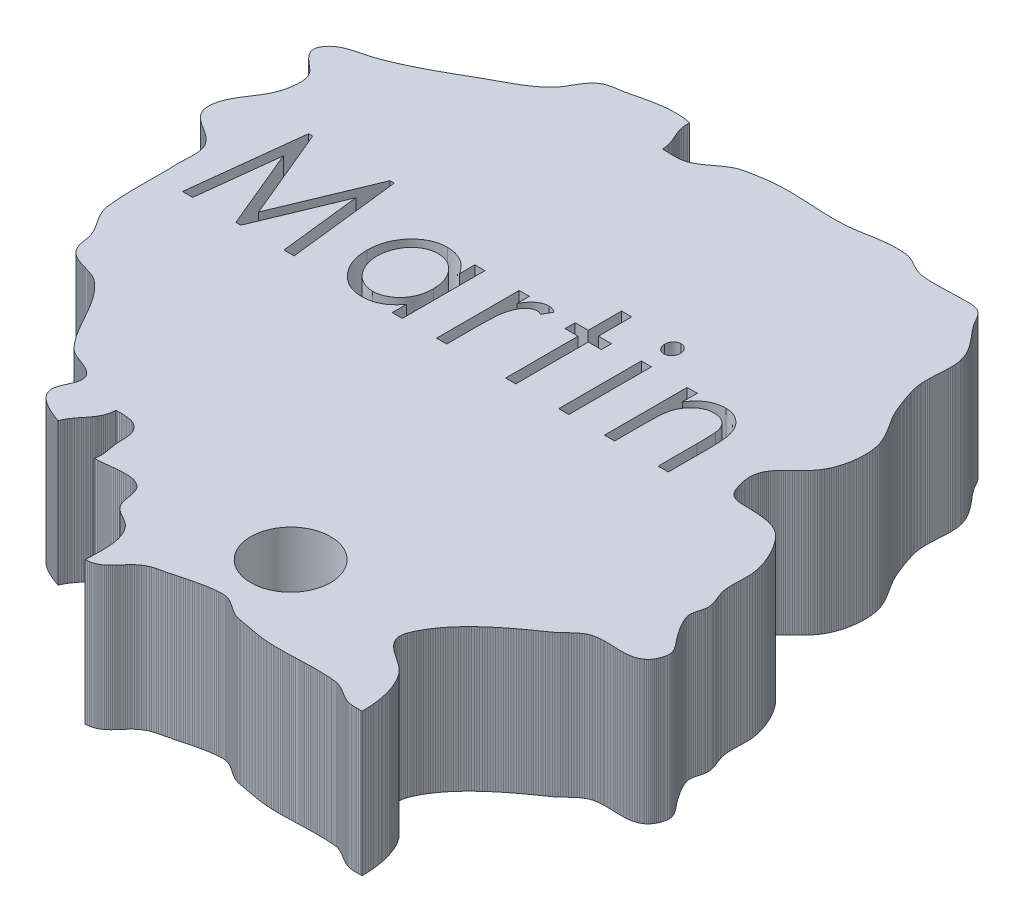
from build123d import *

# Parameters (mm, degrees)
BOSS_EXTRUDE1_DEPTH   = 2
SKETCH1_W             = 0.142467949
SKETCH1_H             = 1.160096154
BOSS_EXTRUDE1_2_DEPTH = 2
SKETCH2_R             = 0.560427
CUT_EXTRUDE1_DEPTH    = 4


with BuildPart() as part:
    # Sketch1 → Boss-Extrude1 (new body)
    with BuildSketch(Plane(origin=(0, 0, 0), x_dir=(1, 0, 0), z_dir=(0, 1, 0))):
        with BuildLine():
            add(Edge.make_bspline(
                [(5.178357098, 6.195814519), (5.160701843, 6.195074753), (5.125776035, 6.193611339), (5.074488584, 6.182057957), (5.025406252, 6.163029209), (4.978734159, 6.136923399), (4.935281677, 6.104176898), (4.89669302, 6.064622526), (4.862599823, 6.019194201), (4.833878764, 5.96841443), (4.810323139, 5.913978043), (4.793420868, 5.857205665), (4.783299996, 5.798770344), (4.781879498, 5.759333526), (4.78116409, 5.739471871)],
                knots=[0, 0, 0, 0, 0.94589833, 1.871185778, 2.803151577, 3.759796684, 4.729387238, 5.709991986, 6.712535966, 7.766410933, 8.830579752, 9.886108481, 10.935375986, 12, 12, 12, 12], degree=3))
            add(Edge.make_bspline(
                [(4.78116409, 5.739471871), (4.781851797, 5.719711547), (4.783221552, 5.6803535), (4.793818467, 5.622080741), (4.810768654, 5.56513725), (4.834040833, 5.510186586), (4.863372336, 5.459095653), (4.897520441, 5.413056849), (4.9366487, 5.373177758), (4.980257461, 5.339936692), (5.026740356, 5.312989873), (5.07572273, 5.294211419), (5.126144692, 5.282084853), (5.160480508, 5.280663047), (5.177721081, 5.279949135)],
                knots=[0, 0, 0, 0, 1.057784853, 2.106865525, 3.161232352, 4.234669004, 5.295131721, 6.309061728, 7.296615406, 8.276535484, 9.237709944, 10.163355204, 11.077790723, 12, 12, 12, 12], degree=3))
            add(Edge.make_bspline(
                [(5.177721081, 5.279949135), (5.195162835, 5.280706342), (5.229976864, 5.282217739), (5.281351871, 5.293755463), (5.33119447, 5.312806554), (5.378848682, 5.339140475), (5.423242562, 5.371802168), (5.463129899, 5.409997742), (5.496574641, 5.454329381), (5.525076638, 5.502993642), (5.547155213, 5.5563562), (5.563444776, 5.61306958), (5.573185059, 5.673203342), (5.574329029, 5.71431304), (5.57491409, 5.735337756)],
                knots=[0, 0, 0, 0, 0.932437919, 1.861161448, 2.801599735, 3.778660743, 4.764224575, 5.742699635, 6.721470402, 7.725153891, 8.751941618, 9.801891719, 10.87582232, 12, 12, 12, 12], degree=3))
            add(Edge.make_bspline(
                [(5.57491409, 5.735337756), (5.57449034, 5.751353436), (5.573657531, 5.782829556), (5.568790941, 5.829195967), (5.559296538, 5.87334354), (5.547120504, 5.915747064), (5.530580297, 5.955789309), (5.511458832, 5.994388786), (5.487476602, 6.030183596), (5.461160581, 6.064240143), (5.431608158, 6.09464368), (5.400870853, 6.122132494), (5.367795344, 6.144881262), (5.332986179, 6.163193933), (5.296826848, 6.178298401), (5.258683954, 6.188124353), (5.219095347, 6.194948851), (5.192061629, 6.195523305), (5.178357098, 6.195814519)],
                knots=[0, 0, 0, 0, 1.135070593, 2.23079002, 3.297312838, 4.331146457, 5.352130785, 6.36323152, 7.377785783, 8.399543416, 9.408885011, 10.377612658, 11.31725054, 12.244650473, 13.161035038, 14.086608181, 15.030021048, 16, 16, 16, 16], degree=3))
        make_face()
    extrude(amount=BOSS_EXTRUDE1_DEPTH)


with BuildPart() as body_2:
    # Sketch1 → Boss-Extrude1 2 (new body)
    with BuildSketch(Plane(origin=(0, 0, 0), x_dir=(1, 0, 0), z_dir=(0, 1, 0))):
        Polygon((11.372342435, 3.810000062), (11.368885496, 3.83661412), (11.363457516, 3.86264404), (11.356419176, 3.8881939), (11.348138776, 3.91337546), (11.338987156, 3.93829794), (11.329327536, 3.9630731), (11.319530756, 3.9878127), (11.309962576, 4.01262342), (11.300988756, 4.03761702), (11.292980136, 4.06290526), (11.286302476, 4.08859482), (11.281324076, 4.1148), (11.278039856, 4.1399333), (11.275690356, 4.16516058), (11.274156196, 4.19046406), (11.273307836, 4.21583358), (11.273025896, 4.24125898), (11.273180836, 4.26672502), (11.273648196, 4.29222408), (11.274308596, 4.31774346), (11.275035036, 4.34327046), (11.275700516, 4.36879238), (11.276185656, 4.3943016), (11.276363456, 4.41978034), (11.276106916, 4.44522352), (11.275294116, 4.47061336), (11.273803136, 4.49594224), (11.271504436, 4.5212), (11.268649476, 4.54394316), (11.265002036, 4.5670978), (11.260579896, 4.59061058), (11.255410996, 4.61443324), (11.249513116, 4.63851498), (11.242914196, 4.662805), (11.235632016, 4.6872525), (11.227694516, 4.71180922), (11.219119476, 4.73642182), (11.209932296, 4.76104204), (11.200155836, 4.78561654), (11.189812956, 4.8100996), (11.178923976, 4.83443534), (11.167514296, 4.85857804), (11.155606776, 4.88247436), (11.143224276, 4.9060735), (11.130387116, 4.9293272), (11.117120696, 4.95218466), (11.103445336, 4.97459254), (11.089386436, 4.99650512), (11.074966856, 5.01786906), (11.060206916, 5.03863356), (11.045129476, 5.05875036), (11.029759936, 5.07816612), (11.014121156, 5.09683258), (10.998233456, 5.11469894), (10.982119696, 5.1317144), (10.965802736, 5.1478307), (10.946808616, 5.1646709), (10.926884856, 5.17995916), (10.906097496, 5.19377168), (10.884520196, 5.20618974), (10.862218996, 5.21729716), (10.839262476, 5.22717014), (10.815719216, 5.2358925), (10.791657796, 5.24354552), (10.767149336, 5.2502054), (10.742259876, 5.25595596), (10.717060536, 5.26087848), (10.691619896, 5.26504916), (10.666003996, 5.26855436), (10.640283956, 5.27147028), (10.614530896, 5.27388074), (10.588810856, 5.27586194), (10.563189876, 5.27750024), (10.537744156, 5.2788693), (10.512534656, 5.28005802), (10.487637576, 5.28114006), (10.463116416, 5.28219924), (10.438521596, 5.2830222), (10.414018216, 5.28351242), (10.389707876, 5.28394168), (10.365702336, 5.28459446), (10.342108276, 5.28574762), (10.319034916, 5.28768056), (10.296588936, 5.29067268), (10.274877016, 5.29500084), (10.254010916, 5.30094952), (10.234097316, 5.30879304), (10.215242896, 5.3188108), (10.197556876, 5.33128474), (10.181145936, 5.34649426), (10.166121836, 5.36471622), (10.152588716, 5.38622748), (10.140655796, 5.41131506), (10.131153656, 5.43534854), (10.122144276, 5.4601364), (10.113744496, 5.48547036), (10.106081316, 5.51113452), (10.099271576, 5.53691806), (10.093437196, 5.56261016), (10.088700096, 5.588), (10.084968836, 5.61495702), (10.082802216, 5.6408955), (10.082131656, 5.66586116), (10.082898736, 5.68990226), (10.085034876, 5.71306198), (10.088479116, 5.73538858), (10.093167956, 5.75693032), (10.099040436, 5.77773038), (10.106027976, 5.79783702), (10.114072156, 5.8172985), (10.123106936, 5.836158), (10.133068816, 5.85446632), (10.143894296, 5.8722641), (10.155522416, 5.88960468), (10.167889676, 5.9065287), (10.180927496, 5.92308442), (10.194579996, 5.93932264), (10.208778596, 5.955284), (10.223462336, 5.9710193), (10.238565176, 5.98657172), (10.254026156, 6.00198952), (10.269781776, 6.01732096), (10.285768536, 6.03260922), (10.301920396, 6.04790256), (10.318178936, 6.06324924), (10.334475576, 6.07869244), (10.350751896, 6.09428042), (10.366941856, 6.1100589), (10.382981956, 6.12607614), (10.398808696, 6.14237786), (10.414358576, 6.15901232), (10.429570636, 6.1760227), (10.444378836, 6.19345726), (10.458719676, 6.21136172), (10.472532196, 6.22978434), (10.485752896, 6.24877084), (10.498788176, 6.26911624), (10.511155436, 6.29014998), (10.522852136, 6.31182634), (10.533883356, 6.33410214), (10.544251636, 6.35693166), (10.553951896, 6.38027172), (10.562994296, 6.4040766), (10.571373756, 6.42829804), (10.579092816, 6.45289794), (10.586156556, 6.4778255), (10.592564976, 6.50304008), (10.598318076, 6.52849596), (10.603415856, 6.55414742), (10.607865936, 6.57994874), (10.611665776, 6.60585928), (10.614815376, 6.63183078), (10.617319816, 6.65781752), (10.619179096, 6.68377886), (10.620395756, 6.70966654), (10.620969796, 6.73543738), (10.620903756, 6.7610482), (10.620197636, 6.78645074), (10.618856516, 6.81160182), (10.616877856, 6.83645572), (10.614266736, 6.8609718), (10.611020616, 6.88509926), (10.607147116, 6.9088), (10.602145856, 6.93345832), (10.596062556, 6.9577712), (10.588968336, 6.98175642), (10.580936856, 7.00542668), (10.572041776, 7.02880484), (10.562354216, 7.05190868), (10.551947836, 7.07475344), (10.540893756, 7.0973569), (10.529263096, 7.11973938), (10.517132056, 7.14191866), (10.504571756, 7.16391252), (10.491653316, 7.1857362), (10.478452936, 7.20741002), (10.465039196, 7.22894922), (10.451485756, 7.25037666), (10.437866276, 7.27170504), (10.424251876, 7.29295468), (10.410716216, 7.3141459), (10.397332956, 7.3352914), (10.384170676, 7.3564115), (10.371305576, 7.37752652), (10.358811316, 7.39864916), (10.347729296, 7.41832908), (10.336718396, 7.43908342), (10.325798936, 7.4608055), (10.314986156, 7.4833861), (10.304300376, 7.50671854), (10.293761916, 7.53069868), (10.283388556, 7.55521476), (10.273200616, 7.5801601), (10.263213336, 7.60543056), (10.253452116, 7.63091438), (10.243929656, 7.65650742), (10.234668816, 7.68210046), (10.225687376, 7.70758682), (10.217005656, 7.73285982), (10.208641436, 7.75781278), (10.200612496, 7.78233648), (10.192941696, 7.80632424), (10.185644276, 7.82966938), (10.178740556, 7.85226268), (10.172250856, 7.874), (10.165829736, 7.8978379), (10.160483036, 7.922006), (10.156137096, 7.9464789), (10.152708096, 7.97122866), (10.150122376, 7.99622988), (10.148296116, 8.02145462), (10.147153116, 8.04688002), (10.146617176, 8.07247814), (10.146604476, 8.09822612), (10.147041356, 8.12409348), (10.147849076, 8.15005482), (10.148943816, 8.17608728), (10.150254456, 8.20216292), (10.151694636, 8.22825634), (10.153193236, 8.2543396), (10.154666436, 8.28038984), (10.156038036, 8.30637912), (10.157226756, 8.33228204), (10.158158936, 8.3580732), (10.158753296, 8.38372466), (10.158928556, 8.40921356), (10.158611056, 8.43450942), (10.157719516, 8.45958938), (10.156177736, 8.48442804), (10.153904436, 8.509), (10.150457656, 8.53457018), (10.145811996, 8.55951044), (10.140028416, 8.58385126), (10.133165336, 8.60762566), (10.125286256, 8.63086412), (10.116452136, 8.6536022), (10.106721396, 8.67586784), (10.096157536, 8.6976966), (10.084818976, 8.71911896), (10.072769216, 8.74017048), (10.060066676, 8.76087656), (10.046772316, 8.78127784), (10.032952176, 8.80139972), (10.018659596, 8.82127776), (10.003960616, 8.84094244), (9.988913656, 8.86042932), (9.973579676, 8.87976634), (9.958022176, 8.89898906), (9.942299576, 8.91812796), (9.926472836, 8.93721606), (9.910605456, 8.95628638), (9.894753316, 8.97536686), (9.878982456, 8.9944956), (9.863351296, 9.01370054), (9.847920796, 9.03301724), (9.832751916, 9.05247618), (9.817905616, 9.07211038), (9.803450476, 9.09296886), (9.789942756, 9.11480524), (9.777003996, 9.13725122), (9.764248116, 9.15994866), (9.751296656, 9.18253434), (9.737771156, 9.2046425), (9.723288076, 9.22591246), (9.707471496, 9.24598354), (9.689935336, 9.26448998), (9.670306216, 9.28107364), (9.648845756, 9.29474138), (9.625965436, 9.30522904), (9.601904016, 9.31293032), (9.576910416, 9.318244), (9.551225936, 9.32156124), (9.525094416, 9.32328336), (9.498762236, 9.32380406), (9.472475776, 9.32351958), (9.446473796, 9.32282616), (9.421005216, 9.32212004), (9.396316416, 9.3218), (9.371411716, 9.32167554), (9.346344456, 9.32133264), (9.321132416, 9.32080686), (9.295790836, 9.32013376), (9.270337496, 9.31935652), (9.244792716, 9.3185107), (9.219169196, 9.3176344), (9.193487256, 9.3167708), (9.167762136, 9.31595038), (9.142016696, 9.31521886), (9.116261096, 9.3146118), (9.090518196, 9.31416476), (9.064803236, 9.31392092), (9.039133996, 9.31391838), (9.013528256, 9.31419016), (8.988001256, 9.31478198), (8.962573316, 9.31572686), (8.937262216, 9.31706798), (8.912083196, 9.31883836), (8.887054036, 9.32107864), (8.862192516, 9.32382946), (8.837516416, 9.32712892), (8.811598256, 9.33206668), (8.786551316, 9.33898564), (8.762243516, 9.34757846), (8.738550396, 9.35754034), (8.715344956, 9.36856648), (8.692495116, 9.38035462), (8.669876416, 9.39259742), (8.647361856, 9.40499516), (8.624821896, 9.41723796), (8.602129536, 9.42902356), (8.579155236, 9.4400497), (8.555777076, 9.45001158), (8.531860436, 9.45860186), (8.507283396, 9.46551828), (8.481916416, 9.47045604), (8.455472476, 9.47400188), (8.429183476, 9.47676794), (8.403034176, 9.47879486), (8.377022036, 9.48012074), (8.351134356, 9.48078622), (8.325363516, 9.48083448), (8.299701896, 9.48030616), (8.274141876, 9.47923936), (8.248673296, 9.4776798), (8.223291076, 9.47566304), (8.197982516, 9.4732348), (8.172739996, 9.47043064), (8.147558436, 9.46729628), (8.122427676, 9.46387236), (8.097337556, 9.46019698), (8.072280456, 9.45631332), (8.047251296, 9.45226202), (8.022237376, 9.44808118), (7.997231076, 9.44381398), (7.972224776, 9.4395036), (7.947213396, 9.4351856), (7.922181696, 9.4309057), (7.897127136, 9.426702), (7.872037016, 9.42261768), (7.846906256, 9.41869084), (7.821727236, 9.41496466), (7.796487256, 9.41147978), (7.771178696, 9.40827684), (7.745799016, 9.40539648), (7.720332976, 9.4028768), (7.694772956, 9.40076352), (7.669116416, 9.39909728), (7.644275216, 9.3978603), (7.619342576, 9.39690018), (7.594321036, 9.39620168), (7.569218216, 9.39574956), (7.544036656, 9.39552604), (7.518778896, 9.39551588), (7.493452556, 9.3957013), (7.468062716, 9.39606706), (7.442611916, 9.39659792), (7.417107776, 9.3972761), (7.391550296, 9.39808636), (7.365949636, 9.39901092), (7.340305796, 9.40003708), (7.314626396, 9.40114452), (7.288916516, 9.40232054), (7.263178696, 9.40354482), (7.237418016, 9.4048072), (7.211639556, 9.40608482), (7.185848396, 9.40736752), (7.160049616, 9.40863498), (7.134248296, 9.40987196), (7.108446976, 9.41106322), (7.082650736, 9.41219352), (7.056864656, 9.41324254), (7.031096356, 9.41420012), (7.005345836, 9.4150434), (6.979620716, 9.41576222), (6.953923536, 9.41633626), (6.928261916, 9.41675028), (6.902638396, 9.41698904), (6.877058056, 9.41703476), (6.851525976, 9.41687474), (6.826044696, 9.41648866), (6.800624376, 9.41586128), (6.775265016, 9.4149799), (6.749971696, 9.4138242), (6.724749496, 9.41237894), (6.699603496, 9.41062888), (6.674538776, 9.40855878), (6.649560416, 9.40614832), (6.624673496, 9.40338734), (6.599878016, 9.40025298), (6.575184136, 9.39673508), (6.550594396, 9.39281332), (6.526116416, 9.388475), (6.501981336, 9.3841824), (6.476809936, 9.37999902), (6.450843516, 9.37580548), (6.424323376, 9.37147732), (6.397490816, 9.36689262), (6.370592216, 9.361932), (6.343863796, 9.35646846), (6.317554476, 9.35038262), (6.291900476, 9.34355256), (6.267150716, 9.33585382), (6.243538876, 9.32716702), (6.221316416, 9.31737024), (6.199124436, 9.30600374), (6.177323616, 9.29370252), (6.155860616, 9.2805885), (6.134682096, 9.26678614), (6.113734716, 9.2524199), (6.092965136, 9.2376117), (6.072322556, 9.222486), (6.051748556, 9.20716726), (6.031194876, 9.19177486), (6.010603096, 9.17643834), (5.989924956, 9.16127708), (5.969104576, 9.146413), (5.948091156, 9.13197564), (5.926826276, 9.11808438), (5.905261676, 9.10486368), (5.883338936, 9.09243546), (5.861012336, 9.08092672), (5.838220916, 9.07045684), (5.814916416, 9.06115536), (5.791421416, 9.05360394), (5.767151716, 9.04780258), (5.742226696, 9.04354808), (5.716773356, 9.04064486), (5.690918696, 9.03888972), (5.664789716, 9.03808708), (5.638510876, 9.03803882), (5.612206636, 9.03854174), (5.586001456, 9.03940026), (5.560024876, 9.04041372), (5.534401356, 9.041384), (5.509257896, 9.04211298), (5.484716416, 9.0424), (5.483248296, 9.06841214), (5.480246016, 9.0935556), (5.475869596, 9.11791166), (5.470296836, 9.1415743), (5.463692836, 9.16462988), (5.456225236, 9.18716984), (5.448066756, 9.20928308), (5.439385036, 9.2310585), (5.430350256, 9.252585), (5.421130056, 9.27395402), (5.411894616, 9.29524938), (5.402811576, 9.31656506), (5.394056196, 9.33798996), (5.385788496, 9.35961044), (5.378186276, 9.38152048), (5.371414636, 9.4038039), (5.365643756, 9.42655214), (5.361041276, 9.44985664), (5.357777376, 9.47380376), (5.356022236, 9.4984824), (5.355946036, 9.52398654), (5.357716416, 9.5504), (5.332354516, 9.55601848), (5.306944356, 9.56083432), (5.281491016, 9.56487546), (5.255994496, 9.56817238), (5.230462416, 9.57075048), (5.204899856, 9.57264278), (5.179309356, 9.57387468), (5.153701076, 9.57447666), (5.128072476, 9.57447666), (5.102433716, 9.5739077), (5.076784796, 9.57279264), (5.051135876, 9.5711645), (5.025489496, 9.56905122), (4.999848196, 9.56648074), (4.974219596, 9.56348608), (4.948608776, 9.5600901), (4.923018276, 9.55632582), (4.897450636, 9.55221864), (4.871916016, 9.54780158), (4.846416956, 9.54310258), (4.820958536, 9.53814958), (4.795545836, 9.53297052), (4.770181396, 9.52759842), (4.744870296, 9.52205614), (4.719620156, 9.5163767), (4.694430976, 9.51059058), (4.669312916, 9.50472318), (4.644268516, 9.49880498), (4.619300316, 9.49286392), (4.594415936, 9.48692794), (4.569620456, 9.48103006), (4.544916416, 9.47519822), (4.519224316, 9.46970166), (4.493265516, 9.46500012), (4.467141616, 9.4607888), (4.440954216, 9.45675782), (4.414804916, 9.45259984), (4.388797856, 9.44801006), (4.363037176, 9.44268368), (4.337621936, 9.43631082), (4.312661356, 9.42858668), (4.288251956, 9.41920138), (4.264497876, 9.4078552), (4.241505796, 9.39423572), (4.221762376, 9.38002442), (4.203309276, 9.36437802), (4.186009336, 9.3474413), (4.169733016, 9.32935396), (4.154348236, 9.31026332), (4.139720376, 9.29031416), (4.125719896, 9.26964872), (4.112214716, 9.24841432), (4.099070216, 9.22675066), (4.086154316, 9.20480506), (4.073337476, 9.1827223), (4.060482536, 9.16064208), (4.047462496, 9.13871426), (4.034142736, 9.11708108), (4.020391176, 9.09588478), (4.006075736, 9.07527268), (3.991064336, 9.05538448), (3.975222356, 9.03637004), (3.958422796, 9.0183716), (3.940464996, 9.00080242), (3.921933156, 8.9836498), (3.902862836, 8.96689342), (3.883281976, 8.95051804), (3.863226136, 8.93450588), (3.842728336, 8.91883916), (3.821819056, 8.90350264), (3.800531316, 8.88847854), (3.778895596, 8.87375162), (3.756947456, 8.85930156), (3.734717376, 8.84511566), (3.712238376, 8.83117106), (3.689543476, 8.8174576), (3.666665696, 8.80395242), (3.643635516, 8.79064282), (3.620485956, 8.77751102), (3.597250036, 8.76453924), (3.573958236, 8.7517097), (3.550646116, 8.73900462), (3.527341616, 8.7264113), (3.504082836, 8.71390942), (3.480897716, 8.70148374), (3.457821816, 8.68911394), (3.434885616, 8.67678732), (3.412122136, 8.6644861), (3.389561856, 8.6521925), (3.367240336, 8.6398862), (3.345188056, 8.62755704), (3.323440576, 8.6151847), (3.301449256, 8.60255074), (3.279412216, 8.58989646), (3.257326916, 8.5772244), (3.235190816, 8.56453964), (3.213008996, 8.5518498), (3.190776376, 8.53915996), (3.168495496, 8.52648028), (3.146166356, 8.51381076), (3.123791496, 8.50116156), (3.101365836, 8.48853776), (3.078894456, 8.47594698), (3.056372276, 8.46339176), (3.033804376, 8.45088226), (3.011190756, 8.43842356), (2.988526336, 8.42602074), (2.965816196, 8.41368142), (2.943060336, 8.40140814), (2.920253676, 8.38921106), (2.897403836, 8.3770978), (2.874503196, 8.36506836), (2.851559376, 8.35313544), (2.828567296, 8.34129904), (2.805526956, 8.32957186), (2.782440896, 8.3179539), (2.759309116, 8.30645532), (2.736131616, 8.2950812), (2.712905856, 8.28383916), (2.689636916, 8.27273174), (2.666319716, 8.2617691), (2.642956796, 8.25095378), (2.619548156, 8.2402934), (2.596096336, 8.22979558), (2.572596256, 8.2194654), (2.549050456, 8.20931048), (2.525458936, 8.19933336), (2.501824236, 8.1895442), (2.478143816, 8.17994554), (2.454417676, 8.170545), (2.430645816, 8.16135274), (2.406830776, 8.15236876), (2.382970016, 8.14360068), (2.359066076, 8.13505866), (2.335116416, 8.12674524), (2.313490856, 8.11969928), (2.291263316, 8.11306734), (2.268527776, 8.10674274), (2.245373136, 8.10062896), (2.221898456, 8.0946244), (2.198190096, 8.08863508), (2.174344576, 8.08255686), (2.150453336, 8.07629322), (2.126607816, 8.0697451), (2.102904536, 8.06280836), (2.079429856, 8.05538902), (2.056282836, 8.04738802), (2.033552376, 8.03870122), (2.011332456, 8.0292321), (1.989714516, 8.01888414), (1.968792536, 8.0075532), (1.948660496, 7.99514276), (1.929407296, 7.98155122), (1.911129456, 7.9666846), (1.893915876, 7.95043622), (1.877860536, 7.93271464), (1.863059956, 7.91341318), (1.849600496, 7.89243786), (1.837581216, 7.86968708), (1.829001096, 7.84783546), (1.824175096, 7.82658074), (1.822826356, 7.80589752), (1.824672936, 7.78575786), (1.829430356, 7.76614144), (1.836821756, 7.74702032), (1.846565196, 7.7283691), (1.858378736, 7.71015984), (1.871980436, 7.69237222), (1.887093436, 7.67497576), (1.903435796, 7.65795014), (1.920723036, 7.64126488), (1.938675756, 7.62489966), (1.957017096, 7.608824), (1.975462576, 7.59301504), (1.993730256, 7.57744738), (2.011540736, 7.56209816), (2.028614616, 7.5469369), (2.044669956, 7.53194074), (2.059427356, 7.51708428), (2.072602336, 7.50234212), (2.083918036, 7.48768632), (2.097603556, 7.46576358), (2.108718596, 7.44281468), (2.117456196, 7.41897678), (2.124009396, 7.39438958), (2.128576316, 7.36919024), (2.131349996, 7.34351846), (2.132526016, 7.31751394), (2.132299956, 7.2913113), (2.130864856, 7.26505532), (2.128416296, 7.23887808), (2.125152396, 7.21292436), (2.121261116, 7.18732878), (2.116943116, 7.16223104), (2.112393976, 7.13777084), (2.107385096, 7.11447396), (2.101385616, 7.09155554), (2.094456496, 7.06899018), (2.086666316, 7.04675756), (2.078078576, 7.02483228), (2.068761856, 7.00319402), (2.058779656, 6.98181992), (2.048200556, 6.96068458), (2.037088056, 6.93977022), (2.025510736, 6.91905144), (2.013534636, 6.89850792), (2.001220716, 6.87811172), (1.988640096, 6.8578476), (1.975858816, 6.83768762), (1.962940376, 6.81761146), (1.949950816, 6.79759626), (1.936958716, 6.77761916), (1.924027576, 6.75765984), (1.911223436, 6.73769036), (1.898614876, 6.71769548), (1.886262856, 6.69764726), (1.874241036, 6.67752284), (1.862607836, 6.65730444), (1.851434376, 6.63696666), (1.840784156, 6.61648664), (1.830723216, 6.59584152), (1.821317596, 6.57500844), (1.812635876, 6.55396708), (1.804739016, 6.53269458), (1.797698136, 6.51116808), (1.791576736, 6.48936472), (1.786440856, 6.4672591), (1.782356536, 6.44483344), (1.779392356, 6.42206234), (1.777609276, 6.39892548), (1.777078416, 6.3754), (1.778008056, 6.35283718), (1.780522656, 6.33142752), (1.784543476, 6.31111006), (1.789986696, 6.2918213), (1.796773576, 6.27350536), (1.804825376, 6.2560962), (1.814063356, 6.2395354), (1.824403696, 6.22376454), (1.835767656, 6.20871504), (1.848076496, 6.19433356), (1.861246396, 6.1805566), (1.875203696, 6.1673232), (1.889862036, 6.15456986), (1.905145216, 6.1422407), (1.920971956, 6.13026968), (1.937260976, 6.11860092), (1.953936076, 6.10716838), (1.970910896, 6.09591364), (1.988111776, 6.08477828), (2.005454896, 6.07369626), (2.022861516, 6.06260916), (2.040252896, 6.05145602), (2.057545216, 6.04017842), (2.074659736, 6.02871032), (2.091517716, 6.01699584), (2.108040416, 6.00496894), (2.124144016, 5.99257374), (2.139752316, 5.9797442), (2.154781496, 5.96642444), (2.169152816, 5.95255096), (2.182787536, 5.9380628), (2.195606916, 5.922899), (2.207524596, 5.90700114), (2.218466916, 5.89030318), (2.228352596, 5.87274924), (2.237097816, 5.85427328), (2.244626376, 5.83481942), (2.250859536, 5.81432416), (2.256310376, 5.79054468), (2.260369296, 5.76622164), (2.263198856, 5.74143632), (2.264961616, 5.7162573), (2.265812516, 5.6907684), (2.265919196, 5.66504582), (2.265441676, 5.63916068), (2.264537436, 5.6131968), (2.263374116, 5.5872253), (2.262109196, 5.56132746), (2.260902696, 5.53557694), (2.259919716, 5.51005248), (2.259320276, 5.48483028), (2.259264396, 5.45998654), (2.259914636, 5.4356), (2.260915396, 5.41080706), (2.261758676, 5.3859049), (2.262459716, 5.36090114), (2.263028676, 5.33579832), (2.263475716, 5.3106066), (2.263813536, 5.28533106), (2.264052296, 5.25997678), (2.264204696, 5.23454884), (2.264280896, 5.2090574), (2.264296136, 5.18350754), (2.264258036, 5.15790434), (2.264179296, 5.13225288), (2.264072616, 5.10656332), (2.263948156, 5.0808382), (2.263818616, 5.05508514), (2.263694156, 5.02930922), (2.263590016, 5.0035206), (2.263511276, 4.97772182), (2.263475716, 4.9519205), (2.263493496, 4.92612426), (2.263572236, 4.90033564), (2.263727176, 4.8745648), (2.263971016, 4.84881428), (2.264311376, 4.82309424), (2.264760956, 4.79740976), (2.265334996, 4.77176592), (2.266041116, 4.7461678), (2.266892016, 4.72062556), (2.267897856, 4.69514174), (2.269073876, 4.6697265), (2.270427696, 4.64438238), (2.271974556, 4.619117), (2.273722076, 4.59393798), (2.275685496, 4.56884786), (2.277872436, 4.5438568), (2.280298136, 4.51897242), (2.282972756, 4.49419472), (2.285908996, 4.4695364), (2.289117016, 4.445), (2.293318176, 4.42053726), (2.299048416, 4.39670952), (2.306173116, 4.37345582), (2.314552576, 4.35072028), (2.324047096, 4.32844448), (2.334524596, 4.30657254), (2.345845376, 4.2850435), (2.357872276, 4.26380402), (2.370468136, 4.24279568), (2.383493256, 4.2219626), (2.396815556, 4.20124382), (2.410292796, 4.18058346), (2.423790356, 4.1599231), (2.437171076, 4.13920686), (2.450295256, 4.11837632), (2.463028276, 4.09737814), (2.475232976, 4.07614882), (2.486769656, 4.05463248), (2.497503696, 4.03277578), (2.507297936, 4.01051522), (2.516012676, 3.9878), (2.523980656, 3.96216886), (2.530160476, 3.9364031), (2.535085536, 3.91056622), (2.539281616, 3.88473442), (2.543282116, 3.85897628), (2.547617896, 3.83335784), (2.552817276, 3.8079553), (2.559411116, 3.78283216), (2.567932816, 3.75806462), (2.578910696, 3.73371872), (2.592878156, 3.70986812), (2.606617016, 3.69096798), (2.621544596, 3.6737544), (2.637571996, 3.65810038), (2.654617936, 3.64388146), (2.672590976, 3.63097572), (2.691409836, 3.61925108), (2.710985616, 3.6085907), (2.731237036, 3.5988625), (2.752072656, 3.5899471), (2.773408656, 3.5817175), (2.795161216, 3.5740467), (2.817243976, 3.56681024), (2.839568036, 3.5598862), (2.862049576, 3.55314504), (2.884604776, 3.54646738), (2.907144736, 3.53972368), (2.929585636, 3.53278948), (2.951838576, 3.52554032), (2.973822276, 3.51785428), (2.995447836, 3.50959928), (3.016631436, 3.50065848), (3.037284176, 3.49090234), (3.057322236, 3.48020386), (3.076659256, 3.46844366), (3.095211416, 3.4554922), (3.112892356, 3.44122756), (3.131668036, 3.42447372), (3.149928096, 3.40733888), (3.167690316, 3.38983574), (3.184977556, 3.37198208), (3.201807596, 3.3537906), (3.218205836, 3.33527654), (3.234187516, 3.31646022), (3.249775496, 3.29735434), (3.264992636, 3.27797668), (3.279859256, 3.25833994), (3.294393136, 3.2384619), (3.308619676, 3.21835526), (3.322554116, 3.19804288), (3.336221856, 3.17753238), (3.349640676, 3.15684662), (3.362833436, 3.13599576), (3.375820456, 3.11499758), (3.388622056, 3.09386986), (3.401258556, 3.0726253), (3.413750276, 3.05128168), (3.426120076, 3.02985424), (3.438388276, 3.00835568), (3.450572656, 2.98680886), (3.462698616, 2.9652214), (3.474783936, 2.94361616), (3.486848936, 2.92200584), (3.498919016, 2.90040314), (3.511006876, 2.87882838), (3.523140456, 2.8572968), (3.535337536, 2.83582364), (3.547620976, 2.8144216), (3.560008556, 2.793111), (3.572520596, 2.77190454), (3.585182496, 2.75082), (3.598012036, 2.72987008), (3.611026996, 2.7090751), (3.624255316, 2.68844776), (3.637712236, 2.66800584), (3.651418076, 2.64776204), (3.665398236, 2.62773414), (3.679670496, 2.60793738), (3.694255176, 2.588387), (3.709172596, 2.56910078), (3.724448156, 2.55009396), (3.740097096, 2.53138178), (3.756142276, 2.51297694), (3.772606556, 2.4949023), (3.790091916, 2.47778016), (3.808839656, 2.46237506), (3.828697376, 2.44848888), (3.849515216, 2.4359235), (3.871138236, 2.42447826), (3.893419116, 2.41396012), (3.916205456, 2.40416588), (3.939347396, 2.39489996), (3.962689996, 2.3859617), (3.986085936, 2.37715806), (4.009380276, 2.36828584), (4.032423156, 2.359152), (4.055064716, 2.34955334), (4.077152556, 2.33929428), (4.098534276, 2.3281767), (4.119060016, 2.31600248), (4.138579916, 2.3025735), (4.156939036, 2.28769164), (4.173990056, 2.27116132), (4.188511236, 2.25342196), (4.199481496, 2.23518222), (4.207190396, 2.21648274), (4.211919876, 2.19736416), (4.213962036, 2.17786966), (4.213598816, 2.15803988), (4.211117236, 2.137918), (4.206806856, 2.11753958), (4.200952156, 2.09695034), (4.193837616, 2.07619346), (4.185755336, 2.0553045), (4.176987256, 2.03432918), (4.167820396, 2.0133056), (4.158544316, 1.99227694), (4.149443496, 1.97128638), (4.140804956, 1.95037202), (4.132913176, 1.9295745), (4.126057716, 1.90893954), (4.120525596, 1.8885027), (4.116598756, 1.8683097), (4.114569296, 1.84840118), (4.114721696, 1.82881778), (4.117579196, 1.80688234), (4.122956376, 1.78580034), (4.130693216, 1.76554892), (4.140619536, 1.7461103), (4.152570236, 1.72746416), (4.166382756, 1.70959272), (4.181891996, 1.6924782), (4.198930316, 1.67609774), (4.217335156, 1.6604361), (4.236938876, 1.64547296), (4.257578916, 1.631188), (4.279087636, 1.6175609), (4.301299936, 1.60457896), (4.324053256, 1.59221424), (4.347182496, 1.58045658), (4.370517476, 1.56928058), (4.393898176, 1.55866846), (4.417156956, 1.54860244), (4.440128716, 1.53906474), (4.462650896, 1.5300325), (4.484553316, 1.52148794), (4.505675956, 1.51341582), (4.525851176, 1.50579074), (4.544916416, 1.4986), (4.554509996, 1.52248616), (4.565030676, 1.5452979), (4.576374316, 1.56713682), (4.588431696, 1.58810198), (4.601106296, 1.60829752), (4.614286356, 1.62781996), (4.627872816, 1.6467709), (4.641758996, 1.66525194), (4.655840756, 1.68336214), (4.670016496, 1.70120056), (4.684179536, 1.71887388), (4.698225736, 1.73647608), (4.712050956, 1.7541113), (4.725551056, 1.7718786), (4.738624436, 1.78987704), (4.751164416, 1.80821076), (4.763064316, 1.82697882), (4.774225076, 1.84628028), (4.784540016, 1.86621674), (4.793904996, 1.8868898), (4.802215876, 1.90839852), (4.809368516, 1.93084196), (4.815261316, 1.95432426), (4.819785056, 1.97894448), (4.822838136, 2.00480168), (4.824316416, 2.032), (4.848954416, 2.0320508), (4.874209636, 2.03217526), (4.899906816, 2.03212192), (4.925865616, 2.03164186), (4.951913316, 2.03048362), (4.977869576, 2.02839828), (5.003561676, 2.02513692), (5.028809276, 2.02045062), (5.053439656, 2.01408538), (5.077275016, 2.00579736), (5.100137556, 1.99533002), (5.121854556, 1.98243698), (5.142245676, 1.96687186), (5.161669056, 1.94815714), (5.177881876, 1.92856358), (5.191188936, 1.90815722), (5.201884876, 1.88701172), (5.210274496, 1.86519312), (5.216657516, 1.84277508), (5.221331116, 1.81982872), (5.224600096, 1.79642008), (5.226764176, 1.77262536), (5.228123076, 1.74850806), (5.228976516, 1.72414438), (5.229626756, 1.69960036), (5.230373516, 1.67494712), (5.231516516, 1.65025578), (5.233360556, 1.6256), (5.236408556, 1.59833564), (5.240203316, 1.57207458), (5.244480676, 1.54662124), (5.248979016, 1.52179274), (5.253434176, 1.49739858), (5.257587076, 1.47325334), (5.261173556, 1.44916906), (5.263931996, 1.42495524), (5.265600776, 1.40042646), (5.265913196, 1.37539222), (5.264612716, 1.34966964), (5.261435176, 1.32306822), (5.256116416, 1.2954), (5.276736136, 1.29576068), (5.298521716, 1.29678684), (5.321353776, 1.29838196), (5.345118016, 1.30044698), (5.369702676, 1.302893), (5.394993456, 1.30561842), (5.420870976, 1.30853434), (5.447223476, 1.3115417), (5.473936656, 1.31454398), (5.500893676, 1.31745228), (5.527982776, 1.32016754), (5.555087116, 1.32259324), (5.582094936, 1.32463794), (5.608886856, 1.32620512), (5.635348576, 1.32719826), (5.661370876, 1.32752592), (5.686834376, 1.32708904), (5.711624776, 1.32579364), (5.735627776, 1.32354828), (5.758729076, 1.32025136), (5.780814376, 1.31581398), (5.801769376, 1.31013962), (5.821477236, 1.30312922), (5.839826196, 1.29469388), (5.862381396, 1.28151128), (5.881868276, 1.26721616), (5.898548456, 1.2518898), (5.912688636, 1.23562364), (5.924547896, 1.2185015), (5.934390396, 1.20060974), (5.942480296, 1.18203472), (5.949076676, 1.16286534), (5.954446236, 1.14318796), (5.958848056, 1.1230864), (5.962548836, 1.10264956), (5.965810196, 1.08196634), (5.968893756, 1.06111802), (5.972063676, 1.04019604), (5.975579036, 1.01928168), (5.979709076, 0.99846892), (5.984712876, 0.97783904), (5.990852056, 0.9574784), (5.998390776, 0.93747844), (6.007593196, 0.91792044), (6.018723476, 0.89889584), (6.032792536, 0.87980266), (6.048741196, 0.86247224), (6.066305296, 0.84664804), (6.085215596, 0.83207098), (6.105213016, 0.81848452), (6.126028316, 0.80563212), (6.147394796, 0.7932547), (6.169050836, 0.78109572), (6.190732276, 0.76889864), (6.212169876, 0.75640184), (6.233099476, 0.74335386), (6.253259456, 0.72949308), (6.272380576, 0.71456296), (6.290198676, 0.69830696), (6.306452136, 0.68046854), (6.321915656, 0.66056002), (6.336050756, 0.64016128), (6.348915856, 0.61929518), (6.360569376, 0.5979922), (6.371064656, 0.5762752), (6.380460116, 0.55417212), (6.388814176, 0.53170836), (6.396182716, 0.50891186), (6.402624156, 0.48580802), (6.408194376, 0.46242224), (6.412951796, 0.438785), (6.416952296, 0.41491916), (6.420251756, 0.39085012), (6.422908596, 0.36660836), (6.424981236, 0.34221674), (6.426525556, 0.31770574), (6.427599976, 0.29309822), (6.428257836, 0.26842212), (6.428560096, 0.24370284), (6.428562636, 0.21896832), (6.428321336, 0.19424396), (6.427897156, 0.16955516), (6.427340896, 0.1449324), (6.426716056, 0.120396), (6.426075976, 0.09597898), (6.425479076, 0.0717042), (6.424981236, 0.04759706), (6.424640876, 0.02368804), (6.424516416, 0), (6.452603736, 0.0026416), (6.478892736, 0.00677418), (6.503507876, 0.01231392), (6.526571076, 0.01917446), (6.548199176, 0.02726436), (6.568519176, 0.03650234), (6.587650456, 0.04680204), (6.605714936, 0.05807202), (6.622834536, 0.07023354), (6.639131176, 0.08319262), (6.654726776, 0.09686798), (6.669743256, 0.11117072), (6.684299996, 0.12601702), (6.698521456, 0.14131798), (6.712529556, 0.15698978), (6.726443676, 0.17294352), (6.740388276, 0.18909284), (6.754482736, 0.20535392), (6.768848976, 0.2216404), (6.783611456, 0.23786338), (6.798889556, 0.2539365), (6.814805196, 0.26977594), (6.831480296, 0.28529534), (6.849036776, 0.30040326), (6.867596556, 0.31502096), (6.887281556, 0.329057), (6.908213696, 0.34242756), (6.932480856, 0.35583114), (6.956930896, 0.36713922), (6.981584136, 0.37667692), (7.006453276, 0.3847719), (7.031556096, 0.39175436), (7.056905296, 0.3979545), (7.082521196, 0.40369744), (7.108416496, 0.40931592), (7.134608976, 0.4151376), (7.161116416, 0.42149014), (7.185650276, 0.42773854), (7.210323836, 0.43413172), (7.235129476, 0.44063158), (7.260057036, 0.44721272), (7.285096356, 0.45384212), (7.310239816, 0.46049184), (7.335479796, 0.46712886), (7.360808676, 0.4737227), (7.386213756, 0.48024796), (7.411687416, 0.48666654), (7.437222036, 0.49295558), (7.462807456, 0.49907952), (7.488436056, 0.50501042), (7.514097676, 0.5107178), (7.539787236, 0.51617118), (7.565492036, 0.52134008), (7.591201916, 0.52619402), (7.616914336, 0.53069998), (7.642614056, 0.53483256), (7.668295996, 0.53855874), (7.693949996, 0.54184804), (7.719568436, 0.54467252), (7.745141156, 0.54699662), (7.770660536, 0.54879494), (7.796116416, 0.550037), (7.820485176, 0.54967886), (7.844053836, 0.54690772), (7.866908756, 0.54196488), (7.889131216, 0.53509418), (7.910807576, 0.52653184), (7.932024196, 0.51651916), (7.952859816, 0.50529744), (7.973405876, 0.49311052), (7.993743656, 0.48019208), (8.013956976, 0.4667885), (8.034132196, 0.45313854), (8.054350596, 0.43948096), (8.074703616, 0.4260596), (8.095267456, 0.41311322), (8.116133556, 0.40088312), (8.137383196, 0.38960806), (8.159102736, 0.37953188), (8.181373456, 0.37089334), (8.204281716, 0.3639312), (8.227916416, 0.35889184), (8.252805876, 0.35464242), (8.277827416, 0.35019234), (8.302965796, 0.34558224), (8.328205776, 0.34085022), (8.353539736, 0.33603692), (8.378952436, 0.3311779), (8.404428636, 0.3263138), (8.429960716, 0.32148272), (8.455533436, 0.3167253), (8.481134096, 0.31208218), (8.506749996, 0.30758638), (8.532370976, 0.30328362), (8.557979256, 0.29920946), (8.583567216, 0.29540454), (8.609119616, 0.29190696), (8.634623756, 0.28875482), (8.660069476, 0.2859913), (8.685441536, 0.28364942), (8.710727236, 0.28177236), (8.735916416, 0.28039822), (8.761133536, 0.27940762), (8.786388756, 0.27865832), (8.811682076, 0.27813254), (8.837005876, 0.27780996), (8.862360156, 0.27767534), (8.887744916, 0.27771598), (8.913152536, 0.27790902), (8.938585556, 0.2782443), (8.964038896, 0.27869896), (8.989510016, 0.2792603), (9.014998916, 0.27991308), (9.040500516, 0.28063698), (9.066012276, 0.28141676), (9.091534196, 0.28223464), (9.117061196, 0.28307792), (9.142593276, 0.28392628), (9.168125356, 0.28476448), (9.193657436, 0.28557728), (9.219186976, 0.28634436), (9.244708896, 0.28705302), (9.270223196, 0.28768294), (9.295727336, 0.28822142), (9.321218776, 0.28864814), (9.346694976, 0.2889504), (9.372150856, 0.28910788), (9.397588956, 0.28910534), (9.423004196, 0.28892754), (9.448394036, 0.2885567), (9.473755936, 0.28797758), (9.499087356, 0.28716986), (9.524388296, 0.28612084), (9.549653676, 0.28481274), (9.574880956, 0.28322778), (9.600067596, 0.28135072), (9.625213596, 0.27916378), (9.650316416, 0.27665426), (9.675701176, 0.27282902), (9.699981036, 0.2670683), (9.723300776, 0.25960324), (9.745802636, 0.25067514), (9.767631396, 0.24051514), (9.788931836, 0.22935946), (9.809843656, 0.21744432), (9.830516716, 0.2050034), (9.851088176, 0.19227546), (9.871707896, 0.17949164), (9.892515576, 0.1668907), (9.913655996, 0.15470886), (9.935273936, 0.1431798), (9.957511636, 0.1325372), (9.980516416, 0.12301982), (10.004941056, 0.11505184), (10.029830516, 0.10924794), (10.055088276, 0.10527284), (10.080622896, 0.10280396), (10.106335316, 0.10151364), (10.132136636, 0.10107422), (10.157930336, 0.10116058), (10.183619896, 0.10144506), (10.209116416, 0.1016), (10.208946236, 0.12509246), (10.208435696, 0.14891512), (10.207569556, 0.17302988), (10.206337656, 0.1974088), (10.204727296, 0.22201378), (10.202733396, 0.24681434), (10.200340716, 0.27177746), (10.197536556, 0.29687012), (10.194315836, 0.3220593), (10.190663316, 0.34731198), (10.186568836, 0.37259514), (10.182024776, 0.39787576), (10.177013356, 0.42312082), (10.171532036, 0.4482973), (10.165563036, 0.47337218), (10.159098736, 0.49831244), (10.152128976, 0.5230876), (10.144641056, 0.54765956), (10.136624816, 0.57200038), (10.128070096, 0.5960745), (10.118964196, 0.6198489), (10.109299496, 0.64329056), (10.099060756, 0.666369), (10.088240356, 0.68904866), (10.076825596, 0.71129652), (10.064808856, 0.73307956), (10.052174896, 0.7543673), (10.038916096, 0.77512418), (10.025019756, 0.79531718), (10.010475716, 0.81491582), (9.995273816, 0.83388708), (9.982368076, 0.84851494), (9.968426016, 0.86278212), (9.953544156, 0.87672418), (9.937824096, 0.89037922), (9.921364896, 0.9037828), (9.904263076, 0.91697048), (9.886622776, 0.92998036), (9.868543056, 0.94285054), (9.850120436, 0.95561404), (9.831456516, 0.96831404), (9.812650356, 0.98098102), (9.793801016, 0.99365308), (9.775012636, 1.00637086), (9.756376656, 1.01916738), (9.737999756, 1.03208074), (9.719980996, 1.04514904), (9.702414356, 1.05840784), (9.685406516, 1.0718927), (9.669051456, 1.08564172), (9.653450776, 1.09969046), (9.638706076, 1.11407956), (9.624916416, 1.12884204), (9.612178316, 1.144016), (9.600593376, 1.159637), (9.590263196, 1.17574568), (9.581284296, 1.19237506), (9.573758276, 1.20956324), (9.567781656, 1.22734578), (9.563458576, 1.24576078), (9.560888096, 1.26484634), (9.560164196, 1.28463802), (9.561393556, 1.30517138), (9.564672696, 1.32648452), (9.570100676, 1.34861554), (9.577779096, 1.3716), (9.586382076, 1.39357354), (9.595559096, 1.41541754), (9.605292376, 1.43713708), (9.615574296, 1.458722), (9.626381996, 1.48017992), (9.637707856, 1.50150068), (9.649534096, 1.5226919), (9.661848016, 1.54374596), (9.674634376, 1.56466286), (9.687880476, 1.5854426), (9.701568536, 1.60608518), (9.715688396, 1.62658552), (9.730222276, 1.64694616), (9.745160016, 1.66716202), (9.760483836, 1.68723564), (9.776181036, 1.70716448), (9.792236376, 1.72694854), (9.808637156, 1.74658274), (9.825365596, 1.76606962), (9.842411536, 1.7854041), (9.859759736, 1.80459126), (9.877394956, 1.82362348), (9.895301956, 1.8425033), (9.913470576, 1.86122818), (9.931880496, 1.87979558), (9.950521556, 1.8982055), (9.969378516, 1.91645794), (9.988438676, 1.93455036), (10.007684256, 1.95248276), (10.027105096, 1.9702526), (10.046683416, 1.98785734), (10.066406516, 2.00529952), (10.086259156, 2.02257406), (10.106228636, 2.03968096), (10.126299716, 2.05662022), (10.146457156, 2.0733893), (10.166688256, 2.0899882), (10.186980316, 2.10641438), (10.207315556, 2.12266784), (10.227681276, 2.13874604), (10.248062236, 2.15464898), (10.268445736, 2.17037412), (10.288816536, 2.18592146), (10.309161936, 2.201291), (10.329466696, 2.21647766), (10.349713036, 2.23148144), (10.369893336, 2.24630234), (10.389987276, 2.26094036), (10.409984696, 2.27539042), (10.429867816, 2.28965506), (10.449626476, 2.30373174), (10.469242896, 2.31761792), (10.488704376, 2.3313136), (10.507998216, 2.34481878), (10.527106636, 2.35813092), (10.546016936, 2.37124748), (10.564716416, 2.38416846), (10.584856076, 2.39883442), (10.604881436, 2.41478308), (10.624835676, 2.43176298), (10.644754356, 2.44953028), (10.664685736, 2.4678386), (10.684670456, 2.48643902), (10.704746616, 2.50508516), (10.724962476, 2.52353318), (10.745356136, 2.54152908), (10.765970776, 2.5588341), (10.786847036, 2.57519678), (10.808030636, 2.5903682), (10.829559676, 2.60410706), (10.851477336, 2.61616444), (10.873826796, 2.62629142), (10.890545076, 2.63245092), (10.907776436, 2.63773666), (10.925482776, 2.6422096), (10.943633616, 2.64592562), (10.962193396, 2.64894314), (10.981131636, 2.65132058), (11.000412776, 2.6531189), (11.020003796, 2.65439398), (11.039874216, 2.65520678), (11.059988476, 2.65561572), (11.080316096, 2.65567668), (11.100818976, 2.65545316), (11.121469176, 2.6549985), (11.142231136, 2.65437366), (11.163071836, 2.6536396), (11.183955716, 2.6528522), (11.204854836, 2.65206988), (11.225733636, 2.6513536), (11.246556556, 2.65075924), (11.267293116, 2.65034776), (11.287910296, 2.65017758), (11.308372536, 2.65030458), (11.328649356, 2.65078972), (11.348705196, 2.65169142), (11.368509576, 2.65307064), (11.388029476, 2.65498072), (11.407226796, 2.65748516), (11.426073596, 2.66063984), (11.444536856, 2.66450318), (11.462578476, 2.66913614), (11.480170516, 2.67459714), (11.497274876, 2.68094206), (11.513863616, 2.68823186), (11.529901176, 2.69652496), (11.545354536, 2.70587724), (11.560188136, 2.7163522), (11.574374036, 2.72800572), (11.587874136, 2.74089876), (11.600657956, 2.75508466), (11.612689936, 2.77062692), (11.623939596, 2.78758396), (11.634373916, 2.80601166), (11.643957336, 2.82596844), (11.652659376, 2.8475178), (11.660444476, 2.87071308), (11.667282156, 2.89561778), (11.672087836, 2.92262814), (11.673106376, 2.94833294), (11.670718776, 2.97285918), (11.665306036, 2.99634148), (11.657244076, 3.01890684), (11.646916436, 3.04068988), (11.634701576, 3.0618176), (11.620983036, 3.08242716), (11.606136736, 3.10264556), (11.590546216, 3.12260742), (11.574589936, 3.14243974), (11.558651436, 3.16227714), (11.543106636, 3.18224916), (11.529172196, 3.20073528), (11.514813576, 3.2200596), (11.500147616, 3.2401383), (11.485303856, 3.26087994), (11.470406756, 3.28220578), (11.455588396, 3.30402438), (11.440970696, 3.32625446), (11.426680656, 3.34880712), (11.412845276, 3.371596), (11.399591556, 3.39453982), (11.387046496, 3.41754968), (11.375334556, 3.44053922), (11.364587816, 3.46342462), (11.354925656, 3.48612206), (11.346480156, 3.5085401), (11.339375776, 3.5306), (11.334458336, 3.55383084), (11.332934336, 3.57696516), (11.334201796, 3.60003852), (11.337663816, 3.62307886), (11.342720956, 3.6461192), (11.348771236, 3.66919002), (11.355212676, 3.6923218), (11.361450916, 3.71554756), (11.366881436, 3.73889524), (11.370907336, 3.7624004), (11.372926636, 3.78609098), align=None)
        Polygon((2.63193332, 5.15783375), (2.81447038, 6.74533375), (2.872347984, 6.74533375), (3.415507038, 5.442769647), (3.956440031, 6.74533375), (4.016225688, 6.74533375), (4.199080756, 5.15783375), (4.055658781, 5.15783375), (3.924321141, 6.29757734), (3.451124025, 5.15783375), (3.381798104, 5.15783375), (2.906692936, 6.29757734), (2.775673304, 5.15783375), align=None, mode=Mode.SUBTRACT)
        with BuildLine():
            Line((5.717382038, 6.317929904), (5.717382038, 5.15783375))
            Line((5.717382038, 5.15783375), (5.57491409, 5.15783375))
            Line((5.57491409, 5.15783375), (5.57491409, 5.358497312))
            add(Edge.make_bspline(
                [(5.57491409, 5.358497312), (5.561096005, 5.340363242), (5.534273755, 5.305163242), (5.488722016, 5.25912823), (5.440835951, 5.220481273), (5.390131014, 5.189603436), (5.336874345, 5.166277413), (5.281324414, 5.149763814), (5.223396383, 5.139059173), (5.183810946, 5.138012286), (5.163728693, 5.137481186)],
                knots=[0, 0, 0, 0, 1.124249619, 2.182278295, 3.187238738, 4.154451045, 5.10316373, 6.0482344, 7.009841688, 8, 8, 8, 8], degree=3))
            add(Edge.make_bspline(
                [(5.163728693, 5.137481186), (5.145886946, 5.138033374), (5.110750138, 5.139120832), (5.059129697, 5.147681521), (5.009536457, 5.161369196), (4.961764026, 5.180529502), (4.916130025, 5.205616243), (4.872387203, 5.235937596), (4.830798573, 5.271934832), (4.791835064, 5.312926009), (4.756230596, 5.357826391), (4.724395181, 5.405239937), (4.697960285, 5.455522242), (4.676290799, 5.508133156), (4.659418342, 5.563073244), (4.647234626, 5.62030155), (4.640283663, 5.679938324), (4.639230707, 5.720479788), (4.638696141, 5.741061915)],
                knots=[0, 0, 0, 0, 0.962923338, 1.896341957, 2.816986366, 3.73633112, 4.668626026, 5.622817781, 6.604924173, 7.633177176, 8.671842852, 9.695721988, 10.712151362, 11.733580008, 12.763695025, 13.811029223, 14.888701295, 16, 16, 16, 16], degree=3))
            add(Edge.make_bspline(
                [(4.638696141, 5.741061915), (4.639198638, 5.761224174), (4.640191116, 5.801046522), (4.647641532, 5.859583225), (4.659787521, 5.915964917), (4.676485982, 5.970172464), (4.698666234, 6.021949351), (4.725582082, 6.071496141), (4.757041923, 6.118973119), (4.79314461, 6.163476906), (4.832478802, 6.204181278), (4.874310671, 6.24012806), (4.918261476, 6.270561098), (4.964483249, 6.29509489), (5.012318088, 6.314795954), (5.062294436, 6.328473042), (5.114280022, 6.336542716), (5.149601798, 6.337696408), (5.167544799, 6.338282468)],
                knots=[0, 0, 0, 0, 1.092124168, 2.1570474, 3.191094433, 4.213739812, 5.224969137, 6.237437074, 7.264796353, 8.306105968, 9.337694135, 10.32749668, 11.28965659, 12.227444396, 13.157391857, 14.086700714, 15.028068948, 16, 16, 16, 16], degree=3))
            add(Edge.make_bspline(
                [(5.167544799, 6.338282468), (5.188047463, 6.337628239), (5.228376408, 6.336341364), (5.287433683, 6.325621324), (5.343356393, 6.307665152), (5.39654658, 6.282991758), (5.44683047, 6.250585416), (5.493223617, 6.209223422), (5.537125243, 6.16024047), (5.562024268, 6.122705302), (5.57491409, 6.103273954)],
                knots=[0, 0, 0, 0, 0.997421046, 1.96193719, 2.909972755, 3.849447145, 4.808316158, 5.810131444, 6.866340535, 8, 8, 8, 8], degree=3))
            Line((5.57491409, 6.103273954), (5.57491409, 6.317929904))
            Line((5.57491409, 6.317929904), (5.717382038, 6.317929904))
        make_face(mode=Mode.SUBTRACT)
        with BuildLine():
            Line((6.197702551, 6.317929904), (6.3401705, 6.317929904))
            Line((6.3401705, 6.317929904), (6.3401705, 6.147159171))
            add(Edge.make_bspline(
                [(6.3401705, 6.147159171), (6.349660212, 6.163014522), (6.367710418, 6.193172694), (6.397531467, 6.233618845), (6.428589549, 6.266699714), (6.460243745, 6.293421875), (6.493098744, 6.313137495), (6.526141754, 6.328038157), (6.560341257, 6.336508625), (6.583404594, 6.33769258), (6.59489556, 6.338282468)],
                knots=[0, 0, 0, 0, 1.32673917, 2.52356624, 3.600745042, 4.579441891, 5.488212785, 6.343964725, 7.174904979, 8, 8, 8, 8], degree=3))
            add(Edge.make_bspline(
                [(6.59489556, 6.338282468), (6.603737243, 6.337728414), (6.622120888, 6.336576425), (6.649928818, 6.328829405), (6.678593769, 6.316245364), (6.696909765, 6.30462588), (6.706516654, 6.298531366)],
                knots=[0, 0, 0, 0, 0.883007402, 1.835950823, 2.864938628, 4, 4, 4, 4], degree=3))
            Line((6.706516654, 6.298531366), (6.637508741, 6.175143946))
            add(Edge.make_bspline(
                [(6.637508741, 6.175143946), (6.631291793, 6.178191917), (6.619559238, 6.183944013), (6.602368056, 6.190886273), (6.586492757, 6.194892969), (6.576362529, 6.195523243), (6.571680916, 6.195814519)],
                knots=[0, 0, 0, 0, 1.19365047, 2.252644048, 3.192472051, 4, 4, 4, 4], degree=3))
            add(Edge.make_bspline(
                [(6.571680916, 6.195814519), (6.561292479, 6.195064164), (6.540106092, 6.193533873), (6.509132477, 6.180996412), (6.478983692, 6.161473386), (6.449641289, 6.134394094), (6.422051119, 6.099522543), (6.398805839, 6.055604758), (6.378395784, 6.003875104), (6.368575992, 5.96592201), (6.363385143, 5.945859591)],
                knots=[0, 0, 0, 0, 0.712300641, 1.452680055, 2.265386686, 3.173289379, 4.185132469, 5.307090938, 6.576498948, 8, 8, 8, 8], degree=3))
            add(Edge.make_bspline(
                [(6.363385143, 5.945859591), (6.361485898, 5.936654742), (6.35727174, 5.916230471), (6.35269108, 5.882136063), (6.349151316, 5.841688201), (6.345506825, 5.795061681), (6.343056934, 5.742142461), (6.34171668, 5.682976102), (6.340204285, 5.617469564), (6.340182103, 5.57167031), (6.3401705, 5.547712556)],
                knots=[0, 0, 0, 0, 0.564633978, 1.25284376, 2.065383872, 3.004330399, 4.062908326, 5.248078739, 6.560460164, 8, 8, 8, 8], degree=3))
            Line((6.3401705, 5.547712556), (6.3401705, 5.15783375))
            Line((6.3401705, 5.15783375), (6.197702551, 5.15783375))
            Line((6.197702551, 5.15783375), (6.197702551, 6.317929904))
        make_face(mode=Mode.SUBTRACT)
        Polygon((7.166484602, 6.786038878), (7.308952551, 6.786038878), (7.308952551, 6.317929904), (7.492125628, 6.317929904), (7.492125628, 6.175461955), (7.308952551, 6.175461955), (7.308952551, 5.15783375), (7.166484602, 5.15783375), (7.166484602, 6.175461955), (6.983311525, 6.175461955), (6.983311525, 6.317929904), (7.166484602, 6.317929904), align=None, mode=Mode.SUBTRACT)
        with BuildLine():
            add(Edge.make_bspline(
                [(7.981986405, 6.806391442), (7.989564781, 6.805987753), (8.004399028, 6.805197555), (8.025765733, 6.798173827), (8.045035903, 6.786450966), (8.062034512, 6.770709709), (8.076852595, 6.752326762), (8.086829315, 6.730871244), (8.093740972, 6.707918095), (8.094283849, 6.691855776), (8.094561525, 6.68364004)],
                knots=[0, 0, 0, 0, 0.981183092, 1.92061116, 2.882914226, 3.885737708, 4.914627404, 5.923374512, 6.937824234, 8, 8, 8, 8], degree=3))
            add(Edge.make_bspline(
                [(8.094561525, 6.68364004), (8.094273853, 6.675637563), (8.09370783, 6.659891971), (8.086839082, 6.637344544), (8.076757927, 6.616168308), (8.062043616, 6.597837737), (8.045033597, 6.582102332), (8.02576632, 6.570377987), (8.004398875, 6.563354639), (7.989564729, 6.562564388), (7.981986405, 6.562160673)],
                knots=[0, 0, 0, 0, 1.0416575, 2.049554848, 3.052591156, 4.08834373, 5.097856223, 6.066578021, 7.012272242, 8, 8, 8, 8], degree=3))
            add(Edge.make_bspline(
                [(7.981986405, 6.562160673), (7.974619059, 6.562570507), (7.960096495, 6.563378375), (7.939077567, 6.570453921), (7.919909678, 6.582109298), (7.902857399, 6.597738283), (7.888526167, 6.616278885), (7.878387942, 6.637330808), (7.871541654, 6.659895546), (7.870972556, 6.675638768), (7.87068332, 6.68364004)],
                knots=[0, 0, 0, 0, 0.966114168, 1.904411113, 2.879123796, 3.894879437, 4.928530644, 5.93777005, 6.951900557, 8, 8, 8, 8], degree=3))
            add(Edge.make_bspline(
                [(7.87068332, 6.68364004), (7.870962619, 6.691854525), (7.871508666, 6.707914399), (7.878397403, 6.730885225), (7.888432786, 6.752215287), (7.902866586, 6.770809091), (7.919907342, 6.786444023), (7.939078153, 6.798097892), (7.960096346, 6.805173817), (7.974619009, 6.805981634), (7.981986405, 6.806391442)],
                knots=[0, 0, 0, 0, 1.068700808, 2.089382387, 3.10432632, 4.131086499, 5.140070417, 6.108284997, 7.040326612, 8, 8, 8, 8], degree=3))
        make_face(mode=Mode.SUBTRACT)
        with Locations((7.982622423, 5.737881827)):
            Rectangle(SKETCH1_W, SKETCH1_H, mode=Mode.SUBTRACT)
        with BuildLine():
            Line((8.554529474, 6.317929904), (8.696997423, 6.317929904))
            Line((8.696997423, 6.317929904), (8.696997423, 6.108680104))
            add(Edge.make_bspline(
                [(8.696997423, 6.108680104), (8.709970572, 6.127624117), (8.735003941, 6.16417904), (8.777391329, 6.212392789), (8.821938486, 6.252458964), (8.868767586, 6.284438247), (8.917994097, 6.308354726), (8.968994531, 6.325816511), (9.022216756, 6.336228285), (9.058422401, 6.337593349), (9.076699947, 6.338282468)],
                knots=[0, 0, 0, 0, 1.185990827, 2.288522695, 3.3091407, 4.275672445, 5.209293633, 6.129359067, 7.055652052, 8, 8, 8, 8], degree=3))
            add(Edge.make_bspline(
                [(9.076699947, 6.338282468), (9.095211359, 6.337498052), (9.131479436, 6.335961204), (9.184334218, 6.323494332), (9.233683721, 6.302594458), (9.279322561, 6.273768447), (9.320269073, 6.237981162), (9.35637875, 6.196497648), (9.385623714, 6.148538035), (9.405609301, 6.104562867), (9.418649991, 6.065343894), (9.427136614, 6.031759258), (9.433909256, 5.994210585), (9.440118692, 5.952989263), (9.444218966, 5.907741701), (9.447937523, 5.85867304), (9.449665689, 5.805736039), (9.449914143, 5.769153384), (9.450042295, 5.750284171)],
                knots=[0, 0, 0, 0, 1.12713107, 2.208306688, 3.288091974, 4.379562174, 5.483123014, 6.591569771, 7.717274597, 8.893962172, 9.527216441, 10.23381506, 11.002852221, 11.851542853, 12.773276241, 13.770613929, 14.85009001, 16, 16, 16, 16], degree=3))
            Line((9.450042295, 5.750284171), (9.450042295, 5.15783375))
            Line((9.450042295, 5.15783375), (9.307574346, 5.15783375))
            Line((9.307574346, 5.15783375), (9.307574346, 5.703536875))
            add(Edge.make_bspline(
                [(9.307574346, 5.703536875), (9.307635857, 5.719331707), (9.307753519, 5.749544858), (9.306955327, 5.792792221), (9.306275108, 5.832011039), (9.305918693, 5.867113053), (9.30443295, 5.898054826), (9.303277896, 5.924884187), (9.301819201, 5.947590339), (9.300302086, 5.961339872), (9.299624126, 5.967484191)],
                knots=[0, 0, 0, 0, 1.434917939, 2.74478331, 3.929469464, 4.998608682, 5.933543807, 6.743407487, 7.438460572, 8, 8, 8, 8], degree=3))
            add(Edge.make_bspline(
                [(9.299624126, 5.967484191), (9.298524852, 5.976735615), (9.296386984, 5.994727795), (9.290413465, 6.020470995), (9.283526335, 6.044695337), (9.274750325, 6.06709879), (9.264059535, 6.087674287), (9.252106567, 6.106652547), (9.237883504, 6.12341995), (9.217649538, 6.14390192), (9.188202879, 6.165162075), (9.147555458, 6.183018189), (9.102089399, 6.194109095), (9.070088184, 6.195231956), (9.053485303, 6.195814519)],
                knots=[0, 0, 0, 0, 0.89520826, 1.741001846, 2.537706727, 3.315672302, 4.049656644, 4.765001622, 5.467152629, 6.159092969, 7.531286849, 8.927463616, 10.405905707, 12, 12, 12, 12], degree=3))
            add(Edge.make_bspline(
                [(9.053485303, 6.195814519), (9.043719115, 6.195594446), (9.024309004, 6.195157054), (8.995525593, 6.1908884), (8.96757892, 6.183805299), (8.940214585, 6.174452123), (8.914195265, 6.161204203), (8.888138927, 6.146589024), (8.863500841, 6.12818202), (8.839638893, 6.107609811), (8.817467069, 6.084835027), (8.796465863, 6.061030201), (8.778115863, 6.035411557), (8.76152373, 6.008648449), (8.746800632, 5.980656283), (8.73440276, 5.951145278), (8.723897354, 5.920424615), (8.718482235, 5.899258599), (8.715759943, 5.888618005)],
                knots=[0, 0, 0, 0, 0.951900127, 1.891883031, 2.829532691, 3.761295011, 4.704398811, 5.672438705, 6.671067516, 7.696982975, 8.742244867, 9.768160327, 10.789587351, 11.810805132, 12.837241228, 13.870163147, 14.929286986, 16, 16, 16, 16], degree=3))
            add(Edge.make_bspline(
                [(8.715759943, 5.888618005), (8.714190724, 5.880788187), (8.710770962, 5.863724856), (8.707200533, 5.835777774), (8.703972616, 5.80343759), (8.701664668, 5.766727191), (8.699200045, 5.725612688), (8.698251888, 5.680111906), (8.697119558, 5.630188317), (8.697039275, 5.595414811), (8.696997423, 5.577287376)],
                knots=[0, 0, 0, 0, 0.613436715, 1.336847711, 2.163535168, 3.110622441, 4.162898823, 5.328117746, 6.607147298, 8, 8, 8, 8], degree=3))
            Line((8.696997423, 5.577287376), (8.696997423, 5.15783375))
            Line((8.696997423, 5.15783375), (8.554529474, 5.15783375))
            Line((8.554529474, 5.15783375), (8.554529474, 6.317929904))
        make_face(mode=Mode.SUBTRACT)
    extrude(amount=BOSS_EXTRUDE1_2_DEPTH)

    # Sketch2 → Cut-Extrude1 (cut)
    with BuildSketch(Plane(origin=(0, 2, 0), x_dir=(1, 0, 0), z_dir=(0, 1, 0))):
        with Locations(Location((7.865563173, 1.442221757, 0), (0, 0, 270))):
            Circle(SKETCH2_R)
    extrude(amount=-CUT_EXTRUDE1_DEPTH, mode=Mode.SUBTRACT)


solid = Compound([part.part, body_2.part])
